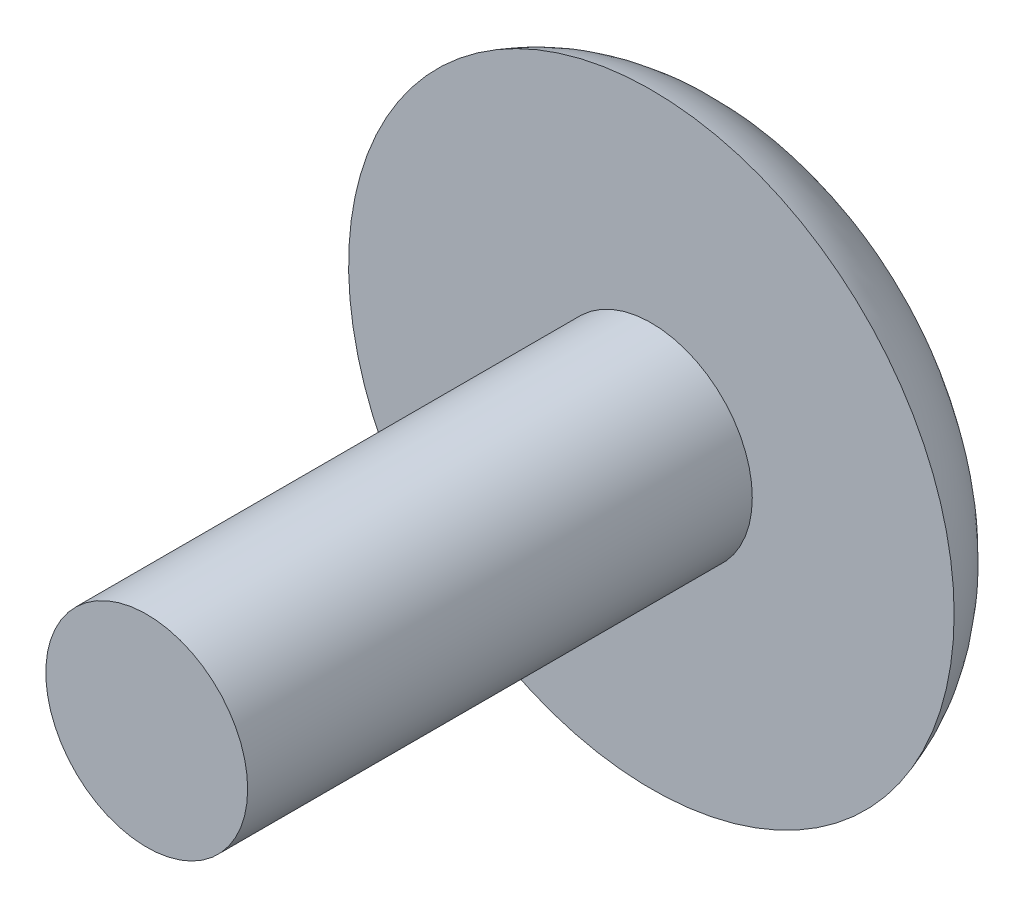
from build123d import *

# Parameters (mm, degrees)
SKETCH_1_R               = 1.5
EXTRUDE_1_DEPTH          = 0.5
SKETCH_2_R               = 0.5
EXTRUDE_2_DEPTH          = 2.5
PATTERN_CIRCULAR_1_COUNT = 4
FILLET_2_R               = 0.7


with BuildPart() as part:
    # 草圖1 → 伸長1 (new body)
    with BuildSketch(Plane.XY):
        Circle(SKETCH_1_R)
    extrude(amount=EXTRUDE_1_DEPTH)

    # 草圖2 → 伸長2 (add)
    with BuildSketch(Plane.XY.offset(0.5)):
        Circle(SKETCH_2_R)
    extrude(amount=EXTRUDE_2_DEPTH)

    # 草圖3 → 除料-疊層拉伸1 section 0
    with BuildSketch(Plane(origin=(0, 0, 0), x_dir=(-1, 0, 0), z_dir=(0, 0, -1)), mode=Mode.PRIVATE) as loft_1_s0:
        with BuildLine():
            Line((-0.115, 1.2), (0.115, 1.2))
            Line((0.115, 1.2), (0.115, -1.2))
            Line((0.115, -1.2), (-0.115, -1.2))
            Line((-0.115, -1.2), (-0.115, 1.2))
        make_face()
    loft_1 = loft([loft_1_s0.sketch, Vertex(0, 0, 0.85)], mode=Mode.SUBTRACT)

    # 環狀複製排列1: 除料-疊層拉伸1 ×4 about axis
    pattern_circular_1_axis = Axis((0, 0, 0), (0, 0, 1))
    for i in range(1, PATTERN_CIRCULAR_1_COUNT):
        add(loft_1.rotate(pattern_circular_1_axis, i * 360 / PATTERN_CIRCULAR_1_COUNT), mode=Mode.SUBTRACT)

    # 圓角2
    # the kernel refuses this fillet: 0.7 mm, written as the material it takes off along each edge
    with BuildSketch(Plane(origin=(0, 0, 0), x_dir=(1, 0, 0), z_dir=(0, -1, 0))) as fillet_2_piece_1:
        with BuildLine():
            CenterArc((0.829179607, 0.7), FILLET_2_R, 270, 73.398450401)
            Line((0.829179607, 0), (0.829179607, -0.014))
            Line((0.829179607, -0.014), (1.5, -0.014))
            Line((1.5, -0.014), (1.514, 0))
            ThreePointArc((1.514, 0), (1.514, 0.25), (1.513416408, 0.496))
            Line((1.513416408, 0.496), (1.5, 0.5))
        make_face()
    revolve(axis=Axis((0, 0, 0), (0, 0, 1)), mode=Mode.SUBTRACT)


solid = part.part
